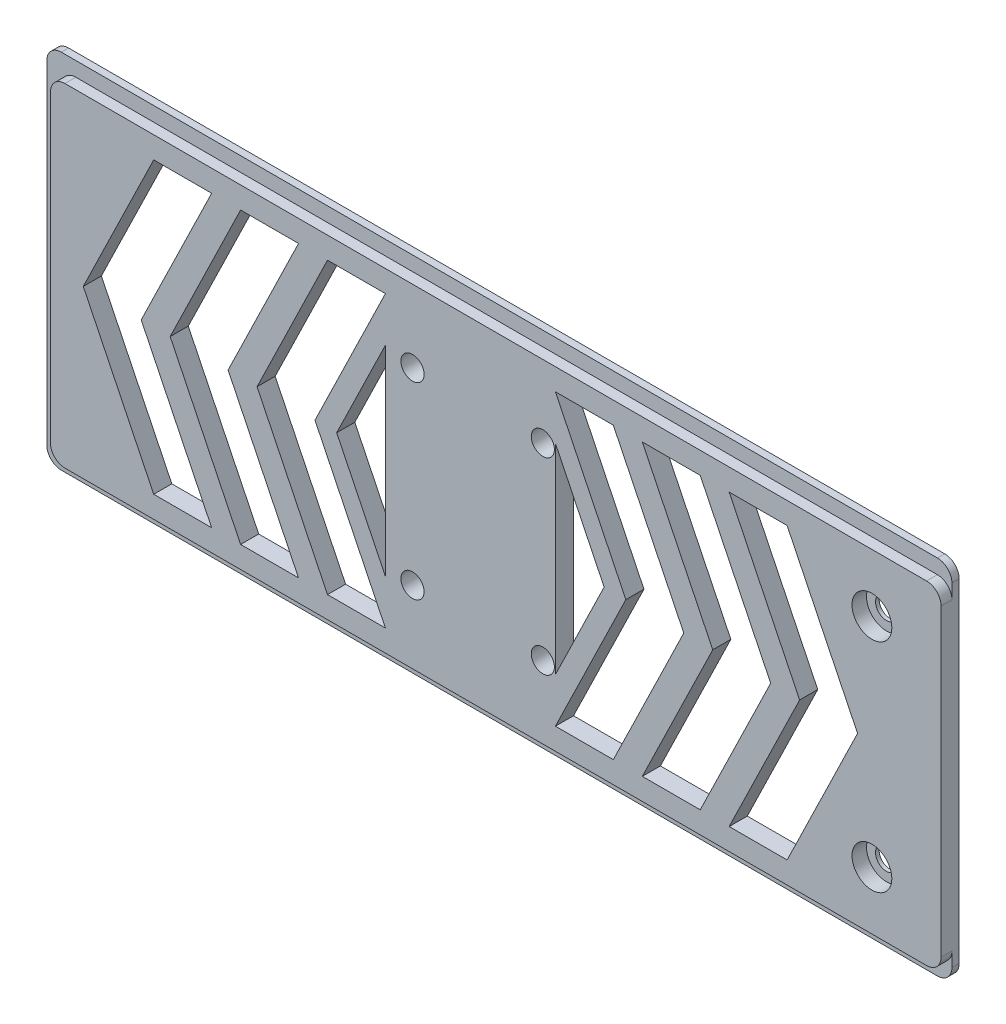
from build123d import *

# Parameters (mm, degrees)
ESBO_O1_W                  = 125
ESBO_O1_H                  = 50
RESSALTO_EXTRUS_O1_DEPTH   = 2.5
ESBO_O2_R                  = 1.6
CORTE_EXTRUS_O2_DEPTH      = 2.5
CORTE_EXTRUS_O3_DEPTH      = 1.5
CORTE_EXTRUS_O5_DEPTH      = 113.726994752
CORTE_EXTRUS_O5_DEPTH_BACK = 113.726994752
ESBO_O12_R                 = 2.75
CORTE_EXTRUS_O6_DEPTH      = 2
ESBO_O19_R                 = 1.5
CORTE_EXTRUS_O7_DEPTH      = 2
FILETE1_R                  = 2


with BuildPart() as part:
    # Esboço1 → Ressalto-extrusão1 (new body)
    with BuildSketch(Plane.XY):
        with Locations((44.657564369, 9.905325444)):
            Rectangle(ESBO_O1_W, ESBO_O1_H)
    extrude(amount=RESSALTO_EXTRUS_O1_DEPTH)

    # Esboço2 → Corte-extrusão2 (cut)
    with BuildSketch(Plane.XY.offset(2.5)):
        with Locations((34.157564369, 22.905325444)):
            Circle(ESBO_O2_R)
        with Locations(Location((34.157564369, -3.094674556, 0), (0, 0, 180))):
            Circle(ESBO_O2_R)
        with Locations((52.157564369, -3.094674556)):
            Circle(ESBO_O2_R)
        with Locations(Location((52.157564369, 22.905325444, 0), (0, 0, 180))):
            Circle(ESBO_O2_R)
    extrude(amount=-CORTE_EXTRUS_O2_DEPTH, mode=Mode.SUBTRACT)

    # Esboço3 → Corte-extrusão3 (cut)
    with BuildSketch(Plane.XY.offset(2.5)):
        Polygon((-17.842435631, 32.905325444), (-17.842435631, 9.905325444), (-15.842435631, 9.905325444), (-15.842435631, 32.905325444), (107.157564369, 32.905325444), (107.157564369, 34.905325444), (-15.842435631, 34.905325444), (-17.842435631, 34.905325444), align=None)
        Polygon((-15.842435631, 9.905325444), (-17.842435631, 9.905325444), (-17.842435631, -13.094674556), (-17.842435631, -15.094674556), (-15.842435631, -15.094674556), (107.157564369, -15.094674556), (107.157564369, -13.094674556), (-15.842435631, -13.094674556), align=None)
    extrude(amount=-CORTE_EXTRUS_O3_DEPTH, mode=Mode.SUBTRACT)

    # Esboço4 → Corte-extrusão5 (cut, two sides: drawn at the far end of the back side and taken through both)
    with BuildSketch(Plane.XY.offset(2.5).offset(-CORTE_EXTRUS_O5_DEPTH_BACK)):
        Polygon((0.690585312, 9.905325444), (10.419553485, -10.094674556), (18.419553485, -10.094674556), (8.690585312, 9.905325444), (18.419553485, 29.905325444), (10.419553485, 29.905325444), align=None)
        Polygon((20.690585312, 9.905325444), (30.419553485, 29.905325444), (22.419553485, 29.905325444), (12.690585312, 9.905325444), (22.419553485, -10.094674556), (30.419553485, -10.094674556), align=None)
        Polygon((30.419553485, 23.738176067), (23.690585312, 9.905325444), (30.419553485, -3.927525179), align=None)
        Polygon((-11.309414688, 9.905325444), (-1.580446515, -10.094674556), (6.419553485, -10.094674556), (-3.309414688, 9.905325444), (6.419553485, 29.905325444), (-1.580446515, 29.905325444), align=None)
        Polygon((95.624543426, 9.905325444), (85.895575254, 29.905325444), (77.895575254, 29.905325444), (87.624543426, 9.905325444), (77.895575254, -10.094674556), (85.895575254, -10.094674556), align=None)
        Polygon((83.624543426, 9.905325444), (73.895575254, 29.905325444), (65.895575254, 29.905325444), (75.624543426, 9.905325444), (65.895575254, -10.094674556), (73.895575254, -10.094674556), align=None)
        Polygon((71.624543426, 9.905325444), (61.895575254, 29.905325444), (53.895575254, 29.905325444), (63.624543426, 9.905325444), (53.895575254, -10.094674556), (61.895575254, -10.094674556), align=None)
        Polygon((60.624543426, 9.905325444), (53.895575254, -3.927525179), (53.895575254, 23.738176067), align=None)
    extrude(amount=CORTE_EXTRUS_O5_DEPTH + CORTE_EXTRUS_O5_DEPTH_BACK, mode=Mode.SUBTRACT)

    # Esboço12 → Corte-extrusão6 (cut)
    with BuildSketch(Plane.XY.offset(2.5)):
        with Locations((97.607564369, 24.905325444)):
            Circle(ESBO_O12_R)
        with Locations((97.607564369, -5.094674556)):
            Circle(ESBO_O12_R)
    extrude(amount=-CORTE_EXTRUS_O6_DEPTH, mode=Mode.SUBTRACT)

    # Esboço19 → Corte-extrusão7 (cut)
    with BuildSketch(Plane.XY.offset(0.5)):
        with Locations((97.607564369, 24.905325444)):
            Circle(ESBO_O19_R)
        with Locations((97.607564369, -5.094674556)):
            Circle(ESBO_O19_R)
    extrude(amount=-CORTE_EXTRUS_O7_DEPTH, mode=Mode.SUBTRACT)

    # Filete1
    filete1_edges = [part.edges().sort_by_distance(p)[0] for p in [
        (-17.842435631, -15.094674556, 0.5),
        (-15.842435631, -13.094674556, 1.75),
        (-17.842435631, 34.905325444, 0.5),
        (-15.842435631, 32.905325444, 1.75),
        (107.157564369, -15.094674556, 0.5),
        (107.157564369, -13.094674556, 1.75),
        (107.157564369, 32.905325444, 1.75),
        (107.157564369, 34.905325444, 0.5),
    ]]
    fillet(filete1_edges, radius=FILETE1_R - 0.0001)  # a hair under: the kernel refuses the full size


solid = part.part
